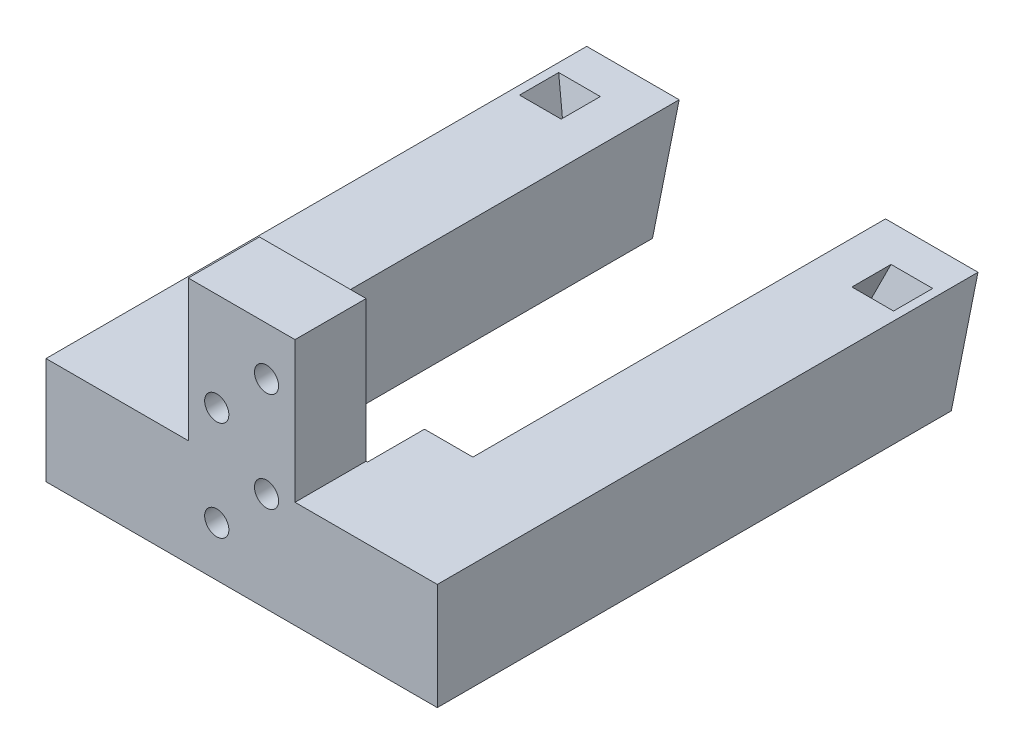
from build123d import *

# Parameters (mm, degrees)
BOSS_EXTRUDE1_DEPTH = 15
SKETCH2_W           = 15
SKETCH2_H           = 10
BOSS_EXTRUDE2_DEPTH = 19.8
CUT_EXTRUDE2_REACH  = 81.519
SKETCH4_R           = 1.7
LPATTERN1_COUNT     = 2
LPATTERN1_PITCH     = 14
CUT_EXTRUDE4_REACH  = 102.06
CUT_EXTRUDE5_START  = -38.811107067
CUT_EXTRUDE5_DEPTH  = 19.709275544
CUT_EXTRUDE6_DEPTH  = 3
CUT_EXTRUDE7_REACH  = 89.185
SKETCH10_R          = 1.85


# Read off the part's stored shape, not the designer's step: Cut-Extrude5
with BuildPart() as part:
    # Sketch1 → Boss-Extrude1 (new body)
    with BuildSketch(Plane(origin=(0, 0, 0), x_dir=(1, 0, 0), z_dir=(0, 1, 0))):
        Polygon((-27.5, 0), (27.5, 0), (27.5, 76), (14.5, 76), (14.5, 18), (7.7, 18), (7.7, 10), (-7.7, 10), (-7.7, 18), (-14.5, 18), (-14.5, 76), (-27.5, 76), align=None)
    extrude(amount=BOSS_EXTRUDE1_DEPTH)

    # Sketch2 → Boss-Extrude2 (add)
    with BuildSketch(Plane(origin=(0, 15, 0), x_dir=(1, 0, 0), z_dir=(0, 1, 0))):
        with Locations((0, 5)):
            Rectangle(SKETCH2_W, SKETCH2_H)
    extrude(amount=BOSS_EXTRUDE2_DEPTH)

    # Sketch4 → Cut-Extrude2 (cut, up to next)
    with BuildSketch(Plane(origin=(0, 0, -10), x_dir=(-1, 0, 0), z_dir=(0, 0, -1)), mode=Mode.PRIVATE) as cut_extrude2_sk1:
        with Locations((-3.5, 28)):
            Circle(SKETCH4_R)
    cut_extrude2_tool1 = extrude(cut_extrude2_sk1.sketch, amount=-CUT_EXTRUDE2_REACH, mode=Mode.PRIVATE) & part.part
    # Sketch4 → Cut-Extrude2 (cut, up to next)
    with BuildSketch(Plane(origin=(0, 0, -10), x_dir=(-1, 0, 0), z_dir=(0, 0, -1)), mode=Mode.PRIVATE) as cut_extrude2_sk2:
        with Locations((3.5, 21)):
            Circle(SKETCH4_R)
    cut_extrude2_tool2 = extrude(cut_extrude2_sk2.sketch, amount=-CUT_EXTRUDE2_REACH, mode=Mode.PRIVATE) & part.part
    cut_extrude2_1 = cut_extrude2_tool1.solids().sort_by_distance((3.5, 28, -10))[0]
    add(cut_extrude2_1, mode=Mode.SUBTRACT)
    cut_extrude2_2 = cut_extrude2_tool2.solids().sort_by_distance((-3.5, 21, -10))[0]
    add(cut_extrude2_2, mode=Mode.SUBTRACT)
    cut_extrude2 = cut_extrude2_1 + cut_extrude2_2  # Cut-Extrude2 as one shape, for the pattern or mirror that repeats it

    # LPattern1: Cut-Extrude2 ×2
    with Locations(*[(0, -i * LPATTERN1_PITCH, 0) for i in range(1, LPATTERN1_COUNT)]):
        add(cut_extrude2, mode=Mode.SUBTRACT)

    # Sketch7 → Cut-Extrude4 (cut, up to next)
    with BuildSketch(Plane.ZY.offset(27.5), mode=Mode.PRIVATE) as cut_extrude4_sk1:
        Polygon((-76, 15), (-72.25, 0), (-76, 0), align=None)
    cut_extrude4_tool1 = extrude(cut_extrude4_sk1.sketch, amount=-CUT_EXTRUDE4_REACH, mode=Mode.PRIVATE) & part.part
    cut_extrude4 = cut_extrude4_tool1.solids().sort_by_distance((-27.5, 5, -74.75))[0]
    add(cut_extrude4, mode=Mode.SUBTRACT)

    # Cut-Extrude5 outline → Cut-Extrude5 (cut)
    with BuildSketch(Plane(origin=(0, 0, 0), x_dir=(0.9396926207859096, 0.3318082769460259, -0.08295206923650612), z_dir=(0.34202014332566544, -0.9116357484973617, 0.2279089371243395)).offset(CUT_EXTRUDE5_START)):
        Polygon((-8.802397208, -59.757011885), (-14.302397208, -59.757011885), (-13.846160827, -65.092795636), (-8.346160827, -65.092795636), align=None)
    cut_extrude5 = extrude(amount=CUT_EXTRUDE5_DEPTH, mode=Mode.SUBTRACT)

    # Sketch9 → Cut-Extrude6 (cut)
    with BuildSketch(Plane(origin=(0, -17, -68), x_dir=(-1, 0, 0), z_dir=(0, -0.24253562503633286, -0.970142500145332))):
        Polygon((21, 22.054021957), (23.771281292, 23.654021957), (23.771281292, 26.854021957), (21, 28.454021957), (18.228718708, 26.854021957), (18.228718708, 23.654021957), align=None)
    cut_extrude6 = extrude(amount=-CUT_EXTRUDE6_DEPTH, mode=Mode.SUBTRACT)

    # Sketch10 → Cut-Extrude7 (cut, up to next)
    with BuildSketch(Plane(origin=(0, -16.272393125, -65.0895725), x_dir=(-1, 0, 0), z_dir=(0, -0.2425356250363299, -0.9701425001453328)), mode=Mode.PRIVATE) as cut_extrude7_sk1:
        with Locations(Location((21, 25.254021957, 0), (0, 0, 90))):
            Circle(SKETCH10_R)
    cut_extrude7_tool1 = extrude(cut_extrude7_sk1.sketch, amount=-CUT_EXTRUDE7_REACH, mode=Mode.PRIVATE) & part.part
    cut_extrude7 = cut_extrude7_tool1.solids().sort_by_distance((-21, 8.227607, -71.214572))[0]
    add(cut_extrude7, mode=Mode.SUBTRACT)

    # Mirror1: Cut-Extrude4, Cut-Extrude5, Cut-Extrude6, Cut-Extrude7 across plane
    add(cut_extrude4.mirror(Plane(origin=(0, 0, 0), x_dir=(0, 0, 1), z_dir=(1, 0, 0))), mode=Mode.SUBTRACT)
    add(cut_extrude5.mirror(Plane(origin=(0, 0, 0), x_dir=(0, 0, 1), z_dir=(1, 0, 0))), mode=Mode.SUBTRACT)
    add(cut_extrude6.mirror(Plane(origin=(0, 0, 0), x_dir=(0, 0, 1), z_dir=(1, 0, 0))), mode=Mode.SUBTRACT)
    add(cut_extrude7.mirror(Plane(origin=(0, 0, 0), x_dir=(0, 0, 1), z_dir=(1, 0, 0))), mode=Mode.SUBTRACT)


solid = part.part
